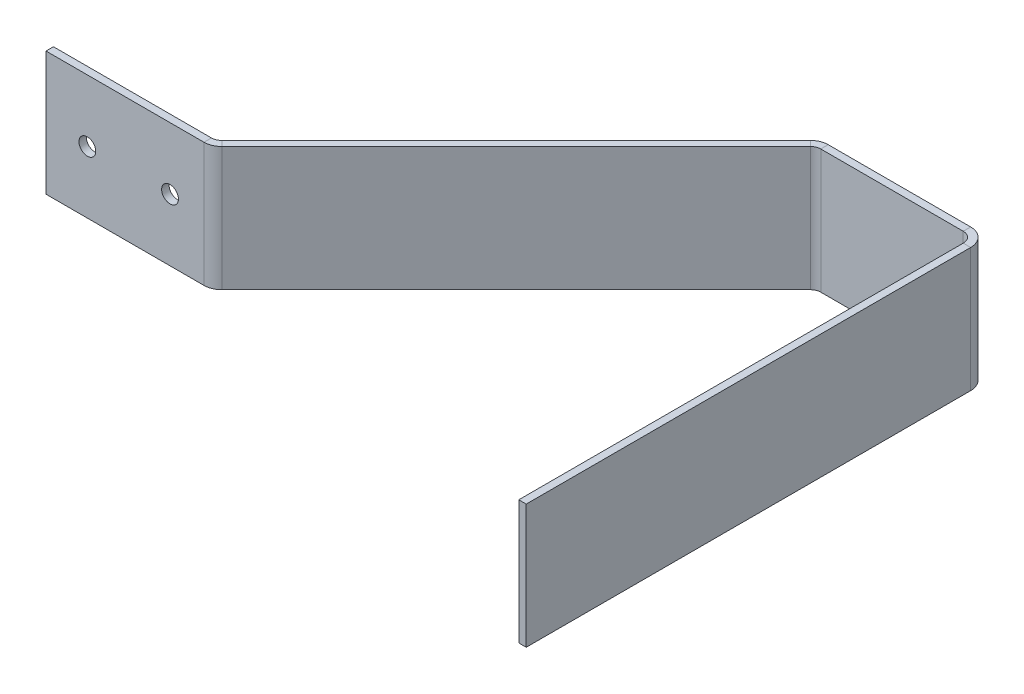
from build123d import *

# Parameters (mm, degrees)
BASE_FLANGE1_DEPTH = 38.1
SKETCH2_R          = 2.5796875
CUT_EXTRUDE1_DEPTH = 219.711637617


# Sheet-metal steps are written as plain solids
with BuildPart() as part:
    # Sketch1 → Base-Flange1 (new body)
    with BuildSketch(Plane(origin=(0, 0, 0), x_dir=(1, 0, 0), z_dir=(0, 1, 0))):
        with BuildLine():
            Line((0, 0), (48.537979736, 0))
            ThreePointArc((48.537979736, 0), (50.62781396, 0.415693873), (52.399489868, 1.599489868))
            Line((52.399489868, 1.599489868), (142.807064676, 92.007064676))
            ThreePointArc((142.807064676, 92.007064676), (143.837108809, 92.695318162), (145.052128706, 92.937000646))
            Line((145.052128706, 92.937000646), (188.822000646, 92.937000646))
            ThreePointArc((188.822000646, 92.937000646), (191.067064676, 92.007064676), (191.997000646, 89.762000646))
            Line((191.997000646, 89.762000646), (191.997000646, -46.762999354))
            Line((191.997000646, -46.762999354), (194.283000646, -46.762999354))
            Line((194.283000646, -46.762999354), (194.283000646, 89.762000646))
            ThreePointArc((194.283000646, 89.762000646), (192.683510778, 93.623510778), (188.822000646, 95.223000646))
            Line((188.822000646, 95.223000646), (145.052128706, 95.223000646))
            ThreePointArc((145.052128706, 95.223000646), (142.962294482, 94.807306773), (141.190618574, 93.623510778))
            Line((141.190618574, 93.623510778), (50.783043766, 3.21593597))
            ThreePointArc((50.783043766, 3.21593597), (49.752999634, 2.527682484), (48.537979736, 2.286))
            Line((48.537979736, 2.286), (0, 2.286))
            Line((0, 2.286), (0, 0))
        make_face()
    extrude(amount=BASE_FLANGE1_DEPTH)

    # Sketch2 → Cut-Extrude1 (cut, through all)
    with BuildSketch(Plane(origin=(0, 0, -2.286), x_dir=(-1, 0, 0), z_dir=(0, 0, -1))):
        with Locations((-12.7, 19.05)):
            Circle(SKETCH2_R)
        with Locations((-38.1, 19.05)):
            Circle(SKETCH2_R)
    extrude(amount=-CUT_EXTRUDE1_DEPTH, mode=Mode.SUBTRACT)


solid = part.part
